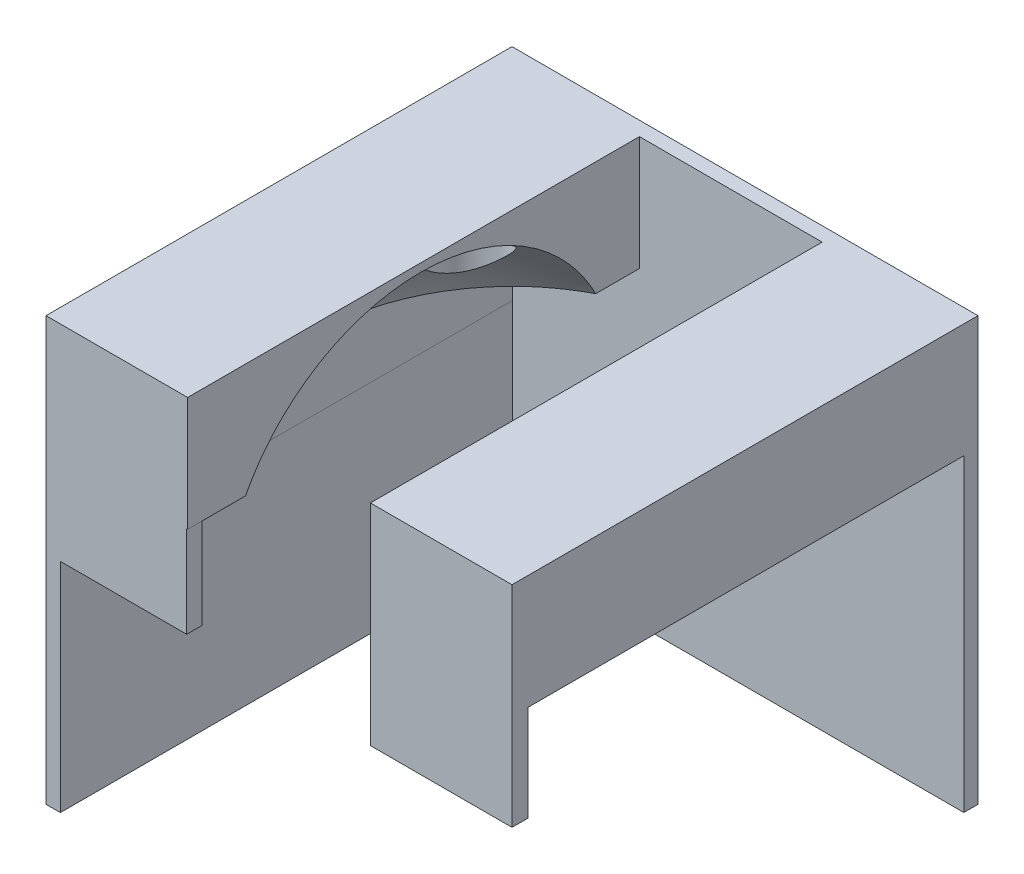
from build123d import *
from build123d.topology import SkipClean

# Parameters (mm, degrees)
SKETCH1_W                   = 102
SKETCH1_H                   = 102
BOSS_EXTRUDE1_DEPTH         = 50
CUT_EXTRUDE_THIN1_OUTLINE_W = 40
CUT_EXTRUDE_THIN1_OUTLINE_H = 95.773670058
CUT_EXTRUDE_THIN1_DEPTH     = 50
SKETCH4_W                   = 40
SKETCH4_H                   = 6.202657501
CUT_EXTRUDE3_DEPTH          = 54
SKETCH5_W                   = 33.817621941
SKETCH5_H                   = 102.594578927
CUT_EXTRUDE4_DEPTH          = 20
SKETCH6_W                   = 27.820383201
SKETCH6_H                   = 98.886835029
CUT_EXTRUDE5_DEPTH          = 20
SKETCH7_W                   = 30.8
SKETCH7_H                   = 3.364819678
BOSS_EXTRUDE2_DEPTH         = 21
SKETCH9_W                   = 31
SKETCH9_H                   = 3.479961613
BOSS_EXTRUDE4_DEPTH         = 21
SKETCH10_W                  = 3.15002448
SKETCH10_H                  = 102
BOSS_EXTRUDE5_DEPTH         = 47.625
SKETCH11_W                  = 98.820383201
SKETCH11_H                  = 3.113164971
BOSS_EXTRUDE6_DEPTH         = 47.625
SKETCH14_W                  = 102
SKETCH14_H                  = 5
CUT_EXTRUDE7_DEPTH          = 105
SKETCH13_R                  = 7.5
CUT_EXTRUDE8_DEPTH          = 20
SKETCH13_4_R                = 7.5
CUT_EXTRUDE9_DEPTH          = 20


# Read off the part's stored shape, not the designer's step: Cut-Extrude-Thin1
with BuildPart() as part:
    # Sketch1 → Boss-Extrude1 (new body)
    with BuildSketch(Plane(origin=(0, 0, 0), x_dir=(1, 0, 0), z_dir=(0, 1, 0))):
        with Locations((-66.567363259, 25.977216604)):
            Rectangle(SKETCH1_W, SKETCH1_H)
    extrude(amount=BOSS_EXTRUDE1_DEPTH)

    # Sketch2 → Cut-Revolve1 (revolve, cut)
    with SkipClean():  # the faces are left unmerged after this step: merging them gives an invalid solid
        with BuildSketch(Plane(origin=(0, 0, 0), x_dir=(1, 0, 0), z_dir=(0, 1, 0))):
            with BuildLine():
                ThreePointArc((-66.567363259, 73.602216604), (-114.192363259, 25.977216604), (-66.567363259, -21.647783396))
                Line((-66.567363259, -21.647783396), (-66.567363259, 73.602216604))
            make_face()
            with BuildLine():
                Line((-66.567363259, 73.602216604), (-66.567363259, -21.647783396))
                ThreePointArc((-66.567363259, -21.647783396), (-32.891402805, -7.69874385), (-18.942363259, 25.977216604))
                ThreePointArc((-18.942363259, 25.977216604), (-32.891402805, 59.653177058), (-66.567363259, 73.602216604))
            make_face()
        revolve(axis=Axis((-66.567363259, 0, 21.647783396), (0, 0, -1)), mode=Mode.SUBTRACT)
    add(part.part.scale(1), mode=Mode.REPLACE)  # the faces are merged on a copy

    # Cut-Extrude-Thin1 outline → Cut-Extrude-Thin1 (cut)
    with BuildSketch(Plane(origin=(0, 0, 0), x_dir=(1, 0, 0), z_dir=(0, 1, 0))):
        with Locations((-66.567363259, 25.977216604)):
            Rectangle(CUT_EXTRUDE_THIN1_OUTLINE_W, CUT_EXTRUDE_THIN1_OUTLINE_H)
    extrude(amount=CUT_EXTRUDE_THIN1_DEPTH, mode=Mode.SUBTRACT)

    # Sketch4 → Cut-Extrude3 (cut)
    with BuildSketch(Plane(origin=(0, 0, 0), x_dir=(1, 0, 0), z_dir=(0, 1, 0))):
        with Locations((-66.567363259, -25.010947176)):
            Rectangle(SKETCH4_W, SKETCH4_H)
    extrude(amount=CUT_EXTRUDE3_DEPTH, mode=Mode.SUBTRACT)

    # Sketch5 → Cut-Extrude4 (cut)
    with BuildSketch(Plane(origin=(0, 0, 0), x_dir=(1, 0, 0), z_dir=(0, 1, 0))):
        with Locations((-29.658552289, 22.56676217)):
            Rectangle(SKETCH5_W, SKETCH5_H)
    extrude(amount=CUT_EXTRUDE4_DEPTH, mode=Mode.SUBTRACT)

    # Sketch6 → Cut-Extrude5 (cut)
    with BuildSketch(Plane(origin=(0, 0, 0), x_dir=(-1, 0, 0), z_dir=(0, -1, 0))):
        with Locations((100.47755486, 24.420634119)):
            Rectangle(SKETCH6_W, SKETCH6_H)
    extrude(amount=-CUT_EXTRUDE5_DEPTH, mode=Mode.SUBTRACT)

    # Sketch7 → Boss-Extrude2 (add)
    with BuildSketch(Plane(origin=(0, 0, 0), x_dir=(1, 0, 0), z_dir=(0, 1, 0))):
        with Locations((-102.167363259, -23.340373557)):
            Rectangle(SKETCH7_W, SKETCH7_H)
    extrude(amount=BOSS_EXTRUDE2_DEPTH)

    # Sketch9 → Boss-Extrude4 (add)
    with BuildSketch(Plane.XZ.offset(-20)):
        with Locations((-31.067363259, 23.28280259)):
            Rectangle(SKETCH9_W, SKETCH9_H)
    extrude(amount=BOSS_EXTRUDE4_DEPTH)

    # Sketch10 → Boss-Extrude5 (add)
    with BuildSketch(Plane.XZ):
        with Locations((-115.992351019, -25.977216604)):
            Rectangle(SKETCH10_W, SKETCH10_H)
    extrude(amount=BOSS_EXTRUDE5_DEPTH)

    # Sketch11 → Boss-Extrude6 (add)
    with BuildSketch(Plane.XZ):
        with Locations((-64.97755486, -75.420634119)):
            Rectangle(SKETCH11_W, SKETCH11_H)
    extrude(amount=BOSS_EXTRUDE6_DEPTH)

    # Sketch14 → Cut-Extrude7 (cut)
    with BuildSketch(Plane(origin=(-15.567363259, 0, 0), x_dir=(0, 0, -1), z_dir=(1, 0, 0))):
        with Locations((25.977216604, 47.5)):
            Rectangle(SKETCH14_W, SKETCH14_H)
    extrude(amount=-CUT_EXTRUDE7_DEPTH, mode=Mode.SUBTRACT)

    # Sketch13 → Cut-Extrude8 (cut)
    with BuildSketch(Plane.XZ.offset(-20)):
        with Locations((-94.167363259, -8.342036282)):
            Circle(SKETCH13_R)
    extrude(amount=-CUT_EXTRUDE8_DEPTH, mode=Mode.SUBTRACT)

    # Sketch13<4> → Cut-Extrude9 (cut)
    with BuildSketch(Plane.XZ.offset(-20)):
        with Locations((-94.167363259, -43.864051633)):
            Circle(SKETCH13_4_R)
    extrude(amount=-CUT_EXTRUDE9_DEPTH, mode=Mode.SUBTRACT)


solid = part.part
